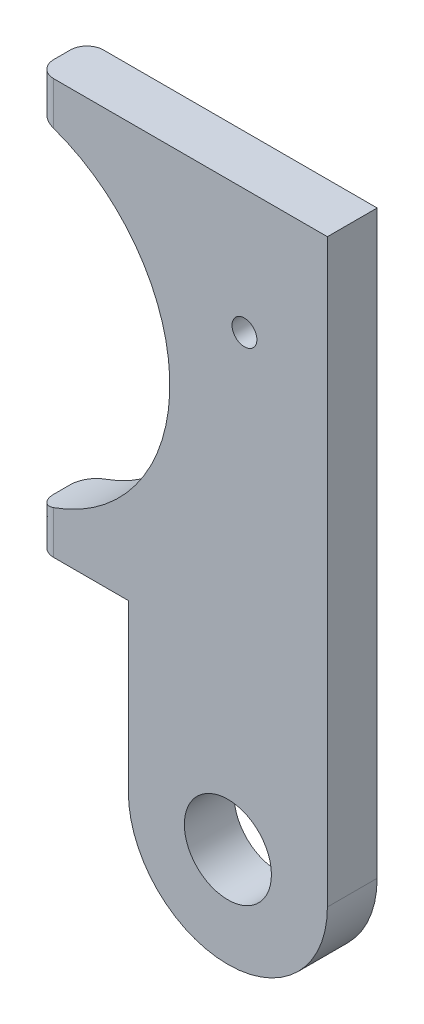
from build123d import *

# Parameters (mm, degrees)
SKETCH1_R           = 0.75
SKETCH1_R_2         = 2.625
BOSS_EXTRUDE1_DEPTH = 3
VARFILLET1_R        = 1
CUT_EXTRUDE1_REACH  = 38.963
SKETCH2_R           = 10.5


with BuildPart() as part:
    # Sketch1 → Boss-Extrude1 (new body)
    with BuildSketch(Plane.XY):
        with BuildLine():
            Line((-6, 10), (-6, 0))
            ThreePointArc((-6, 0), (0, -6), (6, 0))
            Line((6, 0), (6, 35))
            Line((6, 35), (-11.5, 35))
            Line((-11.5, 35), (-11.5, 10))
            Line((-11.5, 10), (-6, 10))
        make_face()
        with Locations((1, 27.5)):
            Circle(SKETCH1_R, mode=Mode.SUBTRACT)
        Circle(SKETCH1_R_2, mode=Mode.SUBTRACT)
    extrude(amount=BOSS_EXTRUDE1_DEPTH)

    # VarFillet1
    varfillet1_edges = [part.edges().sort_by_distance(p)[0] for p in [
        (-11.5, 22.5, 0),
        (-11.5, 22.5, 3),
    ]]
    fillet(varfillet1_edges, radius=VARFILLET1_R)

    # Sketch2 → Cut-Extrude1 (cut, up to next)
    with BuildSketch(Plane.XY.offset(3), mode=Mode.PRIVATE) as cut_extrude1_sk1:
        with Locations((-14, 22.5)):
            Circle(SKETCH2_R)
    cut_extrude1_tool1 = extrude(cut_extrude1_sk1.sketch, amount=-CUT_EXTRUDE1_REACH, mode=Mode.PRIVATE) & part.part
    add(cut_extrude1_tool1.solids().sort_by_distance((-14, 22.5, 3))[0], mode=Mode.SUBTRACT)


solid = part.part
